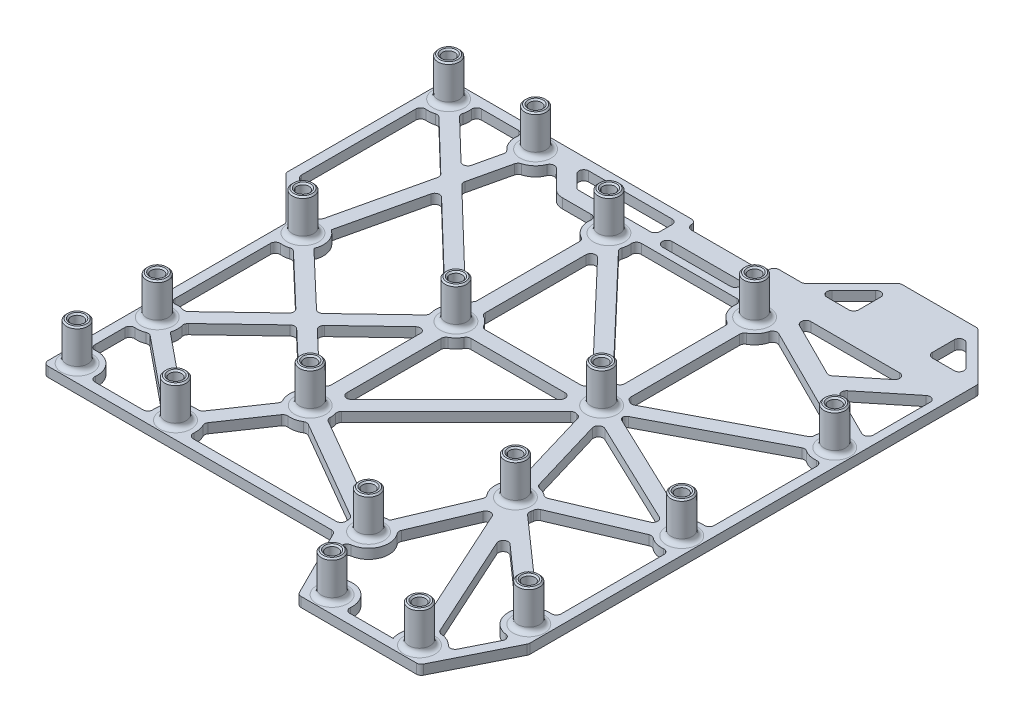
from build123d import *

# Parameters (mm, degrees)
SKETCH1_R                = 1.905
SKETCH1_R_2              = 1.904999999
BOSS_EXTRUDE1_DEPTH      = 2.54
FILLET2_R                = 1.27
BOSS_EXTRUDE2_DEPTH      = 10.16
BOSS_EXTRUDE2_DEPTH_BACK = 2.54
SKETCH3_R                = 2.794
SKETCH3_R_2              = 2.793999999
SKETCH4_R                = 1.5875
CUT_EXTRUDE1_DEPTH       = 119.202141478
CUT_EXTRUDE3_DEPTH       = 2.54
FILLET4_R                = 1.27
BOSS_EXTRUDE3_DEPTH      = 2.54
FILLET5_R                = 1.27
BOSS_EXTRUDE4_DEPTH      = 2.54
FILLET6_R                = 1.27
CUT_EXTRUDE4_DEPTH       = 2.54
CUT_EXTRUDE6_DEPTH       = 2.54
FILLET7_SIZE             = 0.381


with BuildPart() as part:
    # Sketch1 → Boss-Extrude1 (new body)
    with BuildSketch(Plane(origin=(0, 0, 0), x_dir=(1, 0, 0), z_dir=(0, 1, 0))):
        Polygon((-24.130000001, 34.925), (31.115, 34.925), (73.025, 13.97), (73.025, -73.025), (63.5, -92.075), (31.75, -92.075), (22.225, -73.025), (-53.975, -73.025), (-53.975, -9.525), (-65.405000001, 1.905000001), (-65.405000001, 44.45), (-33.655000002, 44.45), align=None)
        with Locations(Location((-9.525, 30.48, 0), (0, 0, 270))):
            Circle(SKETCH1_R, mode=Mode.SUBTRACT)
        with Locations(Location((28.575, 30.48, 0), (0, 0, 270))):
            Circle(SKETCH1_R, mode=Mode.SUBTRACT)
        with Locations(Location((-49.53, -9.525, 0), (0, 0, 270))):
            Circle(SKETCH1_R, mode=Mode.SUBTRACT)
        with Locations(Location((-49.53, -47.625, 0), (0, 0, 270))):
            Circle(SKETCH1_R, mode=Mode.SUBTRACT)
        with Locations(Location((68.58, 11.43, 0), (0, 0, 270))):
            Circle(SKETCH1_R, mode=Mode.SUBTRACT)
        with Locations(Location((68.58, -28.575, 0), (0, 0, 270))):
            Circle(SKETCH1_R, mode=Mode.SUBTRACT)
        with Locations(Location((68.58, -68.58, 0), (0, 0, 270))):
            Circle(SKETCH1_R, mode=Mode.SUBTRACT)
        with Locations(Location((59.055, -87.63, 0), (0, 0, 270))):
            Circle(SKETCH1_R, mode=Mode.SUBTRACT)
        with Locations(Location((36.195, -87.63, 0), (0, 0, 90))):
            Circle(SKETCH1_R, mode=Mode.SUBTRACT)
        with Locations(Location((26.67, -68.58, 0), (0, 0, 90))):
            Circle(SKETCH1_R, mode=Mode.SUBTRACT)
        with Locations(Location((-49.53, -68.58, 0), (0, 0, 270))):
            Circle(SKETCH1_R, mode=Mode.SUBTRACT)
        with Locations(Location((-23.8125, -68.58, 0), (0, 0, 270))):
            Circle(SKETCH1_R, mode=Mode.SUBTRACT)
        with Locations(Location((38.1, -41.5925, 0), (0, 0, 270))):
            Circle(SKETCH1_R, mode=Mode.SUBTRACT)
        with Locations(Location((-9.525, -9.525, 0), (0, 0, 270))):
            Circle(SKETCH1_R, mode=Mode.SUBTRACT)
        with Locations(Location((-9.525, -47.625, 0), (0, 0, 270))):
            Circle(SKETCH1_R, mode=Mode.SUBTRACT)
        with Locations(Location((28.575, -9.525, 0), (0, 0, 270))):
            Circle(SKETCH1_R, mode=Mode.SUBTRACT)
        with Locations(Location((-60.833000001, 39.878, 0), (0, 0, 270))):
            Circle(SKETCH1_R_2, mode=Mode.SUBTRACT)
        with Locations(Location((-38.100000001, 39.878, 0), (0, 0, 270))):
            Circle(SKETCH1_R, mode=Mode.SUBTRACT)
    extrude(amount=BOSS_EXTRUDE1_DEPTH)

    # Fillet2
    fillet2_edges = [part.edges().sort_by_distance(p)[0] for p in [
        (-24.130000001, 1.27, -34.925),
        (31.115, 1.27, -34.925),
        (73.025, 1.27, -13.97),
        (73.025, 1.27, 73.025),
        (63.5, 1.27, 92.075),
        (31.75, 1.27, 92.075),
        (22.225, 1.27, 73.025),
        (-53.975, 1.27, 73.025),
        (-53.975, 1.27, 9.525),
        (-65.405000001, 1.27, -1.905000001),
        (-65.405000001, 1.27, -44.45),
        (-33.655000002, 1.27, -44.45),
    ]]
    fillet(fillet2_edges, radius=FILLET2_R)

    # Sketch3 → Boss-Extrude2 (add, two sides: drawn at the far end of the back side and taken through both)
    with BuildSketch(Plane(origin=(0, 2.54, 0), x_dir=(1, 0, 0), z_dir=(0, 1, 0)).offset(-BOSS_EXTRUDE2_DEPTH_BACK)):
        with Locations(Location((-9.525, 30.48, 0), (0, 0, 270))):
            Circle(SKETCH3_R)
        with Locations(Location((28.575, 30.48, 0), (0, 0, 270))):
            Circle(SKETCH3_R)
        with Locations(Location((-49.53, -9.525, 0), (0, 0, 270))):
            Circle(SKETCH3_R)
        with Locations(Location((-49.53, -47.625, 0), (0, 0, 270))):
            Circle(SKETCH3_R)
        with Locations(Location((68.58, 11.43, 0), (0, 0, 270))):
            Circle(SKETCH3_R)
        with Locations(Location((68.58, -28.575, 0), (0, 0, 270))):
            Circle(SKETCH3_R)
        with Locations(Location((68.58, -68.58, 0), (0, 0, 270))):
            Circle(SKETCH3_R)
        with Locations(Location((36.195, -87.63, 0), (0, 0, 270))):
            Circle(SKETCH3_R)
        with Locations(Location((59.055, -87.63, 0), (0, 0, 270))):
            Circle(SKETCH3_R)
        with Locations(Location((26.67, -68.58, 0), (0, 0, 270))):
            Circle(SKETCH3_R)
        with Locations(Location((-49.53, -68.58, 0), (0, 0, 270))):
            Circle(SKETCH3_R)
        with Locations(Location((-23.8125, -68.58, 0), (0, 0, 270))):
            Circle(SKETCH3_R)
        with Locations(Location((38.1, -41.5925, 0), (0, 0, 270))):
            Circle(SKETCH3_R)
        with Locations(Location((-9.525, -9.525, 0), (0, 0, 270))):
            Circle(SKETCH3_R)
        with Locations(Location((-9.525, -47.625, 0), (0, 0, 270))):
            Circle(SKETCH3_R)
        with Locations(Location((28.575, -9.525, 0), (0, 0, 270))):
            Circle(SKETCH3_R)
        with Locations(Location((-60.833000001, 39.878, 0), (0, 0, 270))):
            Circle(SKETCH3_R_2)
        with Locations(Location((-38.100000001, 39.878, 0), (0, 0, 270))):
            Circle(SKETCH3_R)
    extrude(amount=BOSS_EXTRUDE2_DEPTH + BOSS_EXTRUDE2_DEPTH_BACK)

    # Sketch4 → Cut-Extrude1 (cut, through all)
    with BuildSketch(Plane(origin=(0, 12.7, 0), x_dir=(1, 0, 0), z_dir=(0, 1, 0))):
        with Locations(Location((-60.833000001, 39.878, 0), (0, 0, 270))):
            Circle(SKETCH4_R)
        with Locations(Location((-38.100000001, 39.878, 0), (0, 0, 270))):
            Circle(SKETCH4_R)
        with Locations(Location((-49.53, -9.525, 0), (0, 0, 270))):
            Circle(SKETCH4_R)
        with Locations(Location((-49.53, -47.625, 0), (0, 0, 270))):
            Circle(SKETCH4_R)
        with Locations(Location((-49.53, -68.58, 0), (0, 0, 270))):
            Circle(SKETCH4_R)
        with Locations(Location((-23.8125, -68.58, 0), (0, 0, 270))):
            Circle(SKETCH4_R)
        with Locations(Location((-9.525, -47.625, 0), (0, 0, 270))):
            Circle(SKETCH4_R)
        with Locations(Location((-9.525, -9.525, 0), (0, 0, 270))):
            Circle(SKETCH4_R)
        with Locations(Location((-9.525, 30.48, 0), (0, 0, 270))):
            Circle(SKETCH4_R)
        with Locations(Location((28.575, 30.48, 0), (0, 0, 270))):
            Circle(SKETCH4_R)
        with Locations(Location((28.575, -9.525, 0), (0, 0, 270))):
            Circle(SKETCH4_R)
        with Locations(Location((38.1, -41.5925, 0), (0, 0, 270))):
            Circle(SKETCH4_R)
        with Locations(Location((26.67, -68.58, 0), (0, 0, 270))):
            Circle(SKETCH4_R)
        with Locations(Location((36.195, -87.63, 0), (0, 0, 270))):
            Circle(SKETCH4_R)
        with Locations(Location((59.055, -87.63, 0), (0, 0, 270))):
            Circle(SKETCH4_R)
        with Locations(Location((68.58, -68.58, 0), (0, 0, 270))):
            Circle(SKETCH4_R)
        with Locations(Location((68.58, -28.575, 0), (0, 0, 270))):
            Circle(SKETCH4_R)
        with Locations(Location((68.58, 11.43, 0), (0, 0, 270))):
            Circle(SKETCH4_R)
    extrude(amount=-CUT_EXTRUDE1_DEPTH, mode=Mode.SUBTRACT)

    # Sketch7 → Cut-Extrude3 (cut)
    with BuildSketch(Plane(origin=(0, 2.54, 0), x_dir=(1, 0, 0), z_dir=(0, 1, 0))):
        with BuildLine():
            Line((-32.28975, -28.575), (-47.23597754, -14.340497581))
            ThreePointArc((-47.23597754, -14.340497581), (-49.318378087, -14.854800387), (-51.435, -14.507221492))
            Line((-51.435, -14.507221492), (-51.435, -42.642778508))
            ThreePointArc((-51.435, -42.642778508), (-49.318378087, -42.295199613), (-47.23597754, -42.809502419))
            Line((-47.23597754, -42.809502419), (-32.28975, -28.575))
        make_face()
        with BuildLine():
            Line((-14.435281376, -7.441567061), (-41.142927348, 18.274458392))
            Line((-41.142927348, 18.274458392), (-46.550992638, -5.100401585))
            ThreePointArc((-46.550992638, -5.100401585), (-44.420577676, -7.993543335), (-44.608391333, -11.581532064))
            Line((-44.608391333, -11.581532064), (-29.5275, -25.944285714))
            Line((-29.5275, -25.944285714), (-14.446608667, -11.581532064))
            ThreePointArc((-14.446608667, -11.581532064), (-14.858980035, -9.510405784), (-14.435281376, -7.441567061))
        make_face()
        with BuildLine():
            ThreePointArc((-58.5653629, 35.050021336), (-60.704254901, 34.545553967), (-62.865000001, 34.946212089))
            Line((-62.865000001, 34.946212089), (-62.865000001, 2.957102449))
            Line((-62.865000001, 2.957102449), (-53.703970549, -6.203927002))
            ThreePointArc((-53.703970549, -6.203927002), (-52.172371724, -4.891488624), (-50.26294003, -4.241596276))
            Line((-50.26294003, -4.241596276), (-44.341104785, 21.353891617))
            Line((-44.341104785, 21.353891617), (-58.5653629, 35.050021336))
        make_face()
        with BuildLine():
            ThreePointArc((-41.079007363, 35.453401585), (-43.205593623, 38.333827158), (-43.031787913, 41.909999998))
            Line((-43.031787913, 41.909999998), (-55.901212089, 41.909999998))
            ThreePointArc((-55.901212089, 41.909999998), (-55.499072833, 39.850125825), (-55.922718625, 37.794567061))
            Line((-55.922718625, 37.794567061), (-43.340352006, 25.67936752))
            Line((-43.340352006, 25.67936752), (-41.079007363, 35.453401585))
        make_face()
        with BuildLine():
            Line((-26.298025613, 33.500923164), (-32.766788047, 39.969685597))
            ThreePointArc((-32.766788047, 39.969685597), (-34.047538246, 36.409699303), (-37.367059971, 34.594596276))
            Line((-37.367059971, 34.594596276), (-40.142174568, 22.599934294))
            Line((-40.142174568, 22.599934294), (-11.792637101, -4.697021336))
            ThreePointArc((-11.792637101, -4.697021336), (-11.612743472, -4.616549818), (-11.43, -4.542778508))
            Line((-11.43, -4.542778508), (-11.43, 25.497778508))
            ThreePointArc((-11.43, 25.497778508), (-14.395001021, 28.304075815), (-14.507221492, 32.385))
            Line((-14.507221492, 32.385), (-23.603948777, 32.385))
            ThreePointArc((-23.603948777, 32.385), (-25.061972654, 32.675018981), (-26.298025613, 33.500923164))
        make_face()
        with BuildLine():
            Line((-7.62, 25.497778508), (-7.62, -4.542778508))
            ThreePointArc((-7.62, -4.542778508), (-5.753292429, -5.753292429), (-4.542778508, -7.62))
            Line((-4.542778508, -7.62), (23.592778508, -7.62))
            ThreePointArc((23.592778508, -7.62), (23.67228041, -7.423834461), (23.759502419, -7.23097754))
            Line((23.759502419, -7.23097754), (-7.468467936, 25.558391333))
            ThreePointArc((-7.468467936, 25.558391333), (-7.544002132, 25.527505331), (-7.62, 25.497778508))
        make_face()
        with BuildLine():
            Line((23.592778508, 32.385), (-4.542778508, 32.385))
            ThreePointArc((-4.542778508, 32.385), (-4.195199613, 30.268378087), (-4.709502419, 28.18597754))
            Line((-4.709502419, 28.18597754), (26.518467936, -4.603391333))
            ThreePointArc((26.518467936, -4.603391333), (26.594002132, -4.572505331), (26.67, -4.542778508))
            Line((26.67, -4.542778508), (26.67, 25.497778508))
            ThreePointArc((26.67, 25.497778508), (23.704998979, 28.304075815), (23.592778508, 32.385))
        make_face()
        with BuildLine():
            ThreePointArc((33.904854026, 30.690266656), (33.027669029, 27.543114828), (30.48, 25.497778508))
            Line((30.48, 25.497778508), (30.48, -4.542778508))
            ThreePointArc((30.48, -4.542778508), (31.336325316, -4.961378796), (32.104475589, -5.525705304))
            Line((32.104475589, -5.525705304), (63.282657761, 10.805723453))
            ThreePointArc((63.282657761, 10.805723453), (63.5465717, 13.195263592), (64.832959201, 15.226214068))
            Line((64.832959201, 15.226214068), (33.904854026, 30.690266656))
        make_face()
        with BuildLine():
            Line((65.050524411, 7.430705304), (33.872342239, -8.900723453))
            ThreePointArc((33.872342239, -8.900723453), (33.899827673, -9.21232405), (33.909, -9.525))
            ThreePointArc((33.909, -9.525), (33.904816998, -9.736203147), (33.892274552, -9.947075036))
            Line((33.892274552, -9.947075036), (64.900772389, -24.713026387))
            ThreePointArc((64.900772389, -24.713026387), (67.530852855, -23.345196345), (70.485, -23.592778508))
            Line((70.485, -23.592778508), (70.485, 6.447778508))
            ThreePointArc((70.485, 6.447778508), (67.630649429, 6.181163034), (65.050524411, 7.430705304))
        make_face()
        with BuildLine():
            ThreePointArc((32.254227611, -13.386973613), (32.041973878, -13.578596937), (31.819755895, -13.758570028))
            Line((31.819755895, -13.758570028), (38.507534475, -36.274091248))
            ThreePointArc((38.507534475, -36.274091248), (40.368178975, -36.764775884), (41.933635977, -37.883754768))
            Line((41.933635977, -37.883754768), (63.249937639, -28.7799176))
            ThreePointArc((63.249937639, -28.7799176), (63.24710906, -28.466233185), (63.262725448, -28.152924964))
            Line((63.262725448, -28.152924964), (32.254227611, -13.386973613))
        make_face()
        with BuildLine():
            ThreePointArc((28.167465525, -14.843408752), (27.263957653, -14.695369809), (26.399075815, -14.395001021))
            Line((26.399075815, -14.395001021), (-4.654998979, -45.449075815))
            ThreePointArc((-4.654998979, -45.449075815), (-4.308289281, -46.512576844), (-4.191, -47.625))
            ThreePointArc((-4.191, -47.625), (-4.207972118, -48.050171142), (-4.258780465, -48.472636602))
            Line((-4.258780465, -48.472636602), (23.312728656, -64.435089251))
            ThreePointArc((23.312728656, -64.435089251), (24.978497678, -63.521306899), (26.858875669, -63.24934507))
            Line((26.858875669, -63.24934507), (34.402809021, -45.43728021))
            ThreePointArc((34.402809021, -45.43728021), (32.774345839, -41.294232072), (34.855244105, -37.358929972))
            Line((34.855244105, -37.358929972), (28.167465525, -14.843408752))
        make_face()
        with BuildLine():
            ThreePointArc((-4.542778508, -11.43), (-5.753292429, -13.296707571), (-7.62, -14.507221492))
            Line((-7.62, -14.507221492), (-7.62, -42.642778508))
            ThreePointArc((-7.62, -42.642778508), (-7.483766572, -42.697026574), (-7.349075815, -42.754998979))
            Line((-7.349075815, -42.754998979), (23.704998979, -11.700924185))
            ThreePointArc((23.704998979, -11.700924185), (23.647026574, -11.566233428), (23.592778508, -11.43))
            Line((23.592778508, -11.43), (-4.542778508, -11.43))
        make_face()
        with BuildLine():
            ThreePointArc((-11.43, -14.507221492), (-11.626165539, -14.42771959), (-11.81902246, -14.340497581))
            Line((-11.81902246, -14.340497581), (-26.76525, -28.575))
            Line((-26.76525, -28.575), (-11.81902246, -42.809502419))
            ThreePointArc((-11.81902246, -42.809502419), (-11.626165539, -42.72228041), (-11.43, -42.642778508))
            Line((-11.43, -42.642778508), (-11.43, -14.507221492))
        make_face()
        with BuildLine():
            Line((-14.446608667, -45.568467936), (-29.5275, -31.205714286))
            Line((-29.5275, -31.205714286), (-44.608391333, -45.568467936))
            ThreePointArc((-44.608391333, -45.568467936), (-44.199983883, -47.418883049), (-44.464270621, -49.295311906))
            Line((-44.464270621, -49.295311906), (-26.471555435, -63.956042799))
            ThreePointArc((-26.471555435, -63.956042799), (-24.579707606, -63.301463414), (-22.579794253, -63.390395724))
            Line((-22.579794253, -63.390395724), (-13.905631923, -50.668290974))
            ThreePointArc((-13.905631923, -50.668290974), (-14.829240639, -48.187660862), (-14.446608667, -45.568467936))
        make_face()
        with BuildLine():
            ThreePointArc((-46.870944565, -52.248957201), (-49.112581475, -52.942642125), (-51.435, -52.607221492))
            Line((-51.435, -52.607221492), (-51.435, -63.597778508))
            ThreePointArc((-51.435, -63.597778508), (-45.758292429, -64.808292429), (-44.547778508, -70.485))
            Line((-44.547778508, -70.485), (-28.794721492, -70.485))
            ThreePointArc((-28.794721492, -70.485), (-29.145045638, -68.704551263), (-28.878229379, -66.909688094))
            Line((-28.878229379, -66.909688094), (-46.870944565, -52.248957201))
        make_face()
        with BuildLine():
            ThreePointArc((-6.167728656, -51.769910749), (-8.341238671, -52.825986937), (-10.757705747, -52.814604276))
            Line((-10.757705747, -52.814604276), (-19.431868077, -65.536709026))
            ThreePointArc((-19.431868077, -65.536709026), (-18.517488016, -67.936257747), (-18.830278508, -70.485))
            Line((-18.830278508, -70.485), (21.440096834, -70.485))
            Line((21.440096834, -70.485), (21.687778508, -70.485))
            ThreePointArc((21.687778508, -70.485), (21.364164727, -69.127419456), (21.403780465, -67.732363398))
            Line((21.403780465, -67.732363398), (-6.167728656, -51.769910749))
        make_face()
        with BuildLine():
            ThreePointArc((38.430175423, -46.916271238), (38.170733666, -46.926030983), (37.911124331, -46.92315493))
            Line((37.911124331, -46.92315493), (30.367190979, -64.73521979))
            ThreePointArc((30.367190979, -64.73521979), (31.352196239, -71.135111423), (25.437083428, -73.769554193))
            Line((25.437083428, -73.769554193), (31.303606702, -85.502600741))
            ThreePointArc((31.303606702, -85.502600741), (38.211711032, -82.6919404), (41.177221492, -89.535))
            Line((41.177221492, -89.535), (54.072778508, -89.535))
            ThreePointArc((54.072778508, -89.535), (53.834451816, -86.535727338), (55.257147773, -83.884619583))
            Line((55.257147773, -83.884619583), (38.430175423, -46.916271238))
        make_face()
        with BuildLine():
            Line((43.546062929, -48.958949384), (58.724824577, -82.306228762))
            ThreePointArc((58.724824577, -82.306228762), (61.839847497, -83.080694513), (63.946393298, -85.502600741))
            Line((63.946393298, -85.502600741), (69.812916572, -73.769554193))
            ThreePointArc((69.812916572, -73.769554193), (64.577891618, -72.106284801), (63.586972658, -66.703504873))
            Line((63.586972658, -66.703504873), (43.546062929, -48.958949384))
        make_face()
        with BuildLine():
            Line((64.746364023, -32.283745232), (43.430062361, -41.3875824))
            ThreePointArc((43.430062361, -41.3875824), (43.4330155, -41.490022286), (43.434, -41.5925))
            ThreePointArc((43.434, -41.5925), (43.348064588, -42.546111073), (43.093027342, -43.468995127))
            Line((43.093027342, -43.468995127), (66.112661157, -63.850962568))
            ThreePointArc((66.112661157, -63.850962568), (68.271646655, -63.254920262), (70.485, -63.597778508))
            Line((70.485, -63.597778508), (70.485, -33.557221492))
            ThreePointArc((70.485, -33.557221492), (67.424428873, -33.78232286), (64.746364023, -32.283745232))
        make_face()
    extrude(amount=-CUT_EXTRUDE3_DEPTH, mode=Mode.SUBTRACT)

    # Fillet4
    # the kernel refuses this fillet: 1.27 mm, written as the material it adds along each edge
    with BuildSketch(Plane(origin=(-26.76525, 2.54, 28.575), x_dir=(0.724137931034534, 0, 0.6896551724137392), z_dir=(0, -1, 0)), Plane(origin=(-32.28975, 2.54, 28.575), x_dir=(-0.7241379310345379, 0, -0.6896551724137352), z_dir=(0, -1, 0))) as fillet4_piece_1:
        with BuildLine():
            CenterArc((FILLET4_R * 1.05, -FILLET4_R), FILLET4_R, 90, 92.794362055)
            Line((FILLET4_R * 0.0511890606423, -FILLET4_R * 1.04875148633), (0, 0))
            Line((0, 0), (FILLET4_R * 1.05, 0))
        make_face()
    extrude(amount=2.54)
    with BuildSketch(Plane(origin=(-4.542778508, 2.54, 11.43), x_dir=(1, 0, 0), z_dir=(0, -1, 0)), Plane(origin=(-6.167728656, 2.54, 51.769910749), x_dir=(0.8654262854811297, 0, 0.5010362705416985), z_dir=(0, -1, 0)), Plane(origin=(-26.471555435, 2.54, 63.956042799), x_dir=(-0.7752349855172392, 0, -0.6316729511622972), z_dir=(0, -1, 0)), Plane(origin=(-46.870944565, 2.54, 52.248957201), x_dir=(0.7752349855172418, 0, 0.631672951162294), z_dir=(0, -1, 0)), Plane(origin=(63.282657761, 2.54, -10.805723453), x_dir=(-0.8858315352801304, 0, 0.4640069946706056), z_dir=(0, -1, 0)), Plane(origin=(26.67, 2.54, -25.497778508), x_dir=(0, 0, 1), z_dir=(0, -1, 0)), Plane(origin=(-58.5653629, 2.54, -35.050021336), x_dir=(0.720353208670372, 0, 0.6936074212105141), z_dir=(0, -1, 0)), Plane(origin=(-14.446608667, 2.54, 11.581532064), x_dir=(-0.7241379310345665, 0, 0.6896551724137052), z_dir=(0, -1, 0)), Plane(origin=(-41.079007363, 2.54, -35.453401585), x_dir=(-0.22540821761759244, 0, 0.9742644073507253), z_dir=(0, -1, 0)), Plane(origin=(66.112661157, 2.54, 63.850962568), x_dir=(-0.7486987677964876, 0, -0.6629103673197615), z_dir=(0, -1, 0))) as fillet4_piece_2:
        with BuildLine():
            CenterArc((0.80847717, 1.27), FILLET4_R, 208.735653745, 61.264346255)
            ThreePointArc((-0.305118727, 0.659423077), (-0.141318066, 0.334912949), (0, 0))
            Line((0, 0), (0.80847717, 0))
        make_face()
    extrude(amount=2.54)
    with BuildSketch(Plane(origin=(-7.62, 2.54, 14.507221492), x_dir=(0, 0, 1), z_dir=(0, -1, 0)), Plane(origin=(41.933635977, 2.54, 37.883754768), x_dir=(0.919639798457005, 0, -0.39276283059113304), z_dir=(0, -1, 0)), Plane(origin=(-4.258780465, 2.54, 48.472636602), x_dir=(0.8654262854811545, 0, 0.5010362705416558), z_dir=(0, -1, 0)), Plane(origin=(26.399075815, 2.54, 14.395001021), x_dir=(-0.7071067811865871, 0, 0.707106781186508), z_dir=(0, -1, 0)), Plane(origin=(21.403780465, 2.54, 67.732363398), x_dir=(-0.8654262854811073, 0, -0.5010362705417373), z_dir=(0, -1, 0)), Plane(origin=(-10.757705747, 2.54, 52.814604276), x_dir=(-0.5633368246416713, 0, 0.8262273428074375), z_dir=(0, -1, 0)), Plane(origin=(-14.446608667, 2.54, 45.568467936), x_dir=(-0.7241379310345635, 0, -0.6896551724137084), z_dir=(0, -1, 0)), Plane(origin=(-22.579794253, 2.54, 63.390395724), x_dir=(0.5633368246416699, 0, -0.8262273428074386), z_dir=(0, -1, 0)), Plane(origin=(-28.878229379, 2.54, 66.909688094), x_dir=(-0.7752349855172788, 0, -0.6316729511622486), z_dir=(0, -1, 0)), Plane(origin=(30.48, 2.54, -25.497778508), x_dir=(0, 0, 1), z_dir=(0, -1, 0)), Plane(origin=(32.104475589, 2.54, 5.525705304), x_dir=(0.8858315352801891, 0, -0.4640069946704932), z_dir=(0, -1, 0)), Plane(origin=(33.892274552, 2.54, 9.947075036), x_dir=(0.9028605188239747, 0, 0.42993358039225477), z_dir=(0, -1, 0)), Plane(origin=(-4.542778508, 2.54, 7.62), x_dir=(1, 0, 0), z_dir=(0, -1, 0)), Plane(origin=(-4.709502419, 2.54, -28.18597754), x_dir=(0.6896551724137642, 0, 0.7241379310345104), z_dir=(0, -1, 0)), Plane(origin=(-50.26294003, 2.54, 4.241596276), x_dir=(0.22540821761752847, 0, -0.97426440735074), z_dir=(0, -1, 0)), Plane(origin=(-14.435281376, 2.54, 7.441567061), x_dir=(-0.720353208670406, 0, -0.6936074212104788), z_dir=(0, -1, 0)), Plane(origin=(-55.922718625, 2.54, -37.794567061), x_dir=(0.7203532086704016, 0, 0.6936074212104834), z_dir=(0, -1, 0)), Plane(origin=(-37.367059971, 2.54, -34.594596276), x_dir=(-0.2254082176175211, 0, 0.9742644073507418), z_dir=(0, -1, 0)), Plane(origin=(43.093027342, 2.54, 43.468995127), x_dir=(0.7486987677965211, 0, 0.6629103673197235), z_dir=(0, -1, 0)), Plane(origin=(64.746364023, 2.54, 32.283745232), x_dir=(-0.9196397984570056, 0, 0.392762830591132), z_dir=(0, -1, 0)), Plane(origin=(-47.23597754, 2.54, 42.809502419), x_dir=(0.7241379310345717, 0, -0.6896551724136996), z_dir=(0, -1, 0))) as fillet4_piece_3:
        with BuildLine():
            CenterArc((0.80847717, -1.27), FILLET4_R, 90, 61.264346255)
            ThreePointArc((-0.305118727, -0.659423077), (-0.141318066, -0.334912949), (0, 0))
            Line((0, 0), (0.80847717, 0))
        make_face()
    extrude(amount=2.54)
    with BuildSketch(Plane(origin=(38.507534475, 2.54, 36.274091248), x_dir=(0.989557863722872, 0, 0.14413616598281503), z_dir=(0, -1, 0)), Plane(origin=(-4.654998979, 2.54, 45.449075815), x_dir=(0.34480277541816917, 0, 0.9386751547068494), z_dir=(0, -1, 0)), Plane(origin=(34.402809021, 2.54, 45.43728021), x_dir=(-0.6719231740010451, 0, -0.740620853230829), z_dir=(0, -1, 0)), Plane(origin=(28.167465525, 2.54, 14.843408752), x_dir=(-0.9895578637228755, 0, -0.1441361659827925), z_dir=(0, -1, 0)), Plane(origin=(30.367190979, 2.54, 64.73521979), x_dir=(0.6719231740009847, 0, 0.7406208532308838), z_dir=(0, -1, 0)), Plane(origin=(-19.431868077, 2.54, 65.536709026), x_dir=(0.5132848380764649, 0, 0.858218314300515), z_dir=(0, -1, 0)), Plane(origin=(-13.905631923, 2.54, 50.668290974), x_dir=(-0.5132848380764508, 0, -0.8582183143005232), z_dir=(0, -1, 0)), Plane(origin=(-44.608391333, 2.54, 45.568467936), x_dir=(0.3218125531119515, 0, 0.9468034012716512), z_dir=(0, -1, 0)), Plane(origin=(30.48, 2.54, 4.542778508), x_dir=(0.9075559478945641, 0, 0.4199311865546539), z_dir=(0, -1, 0)), Plane(origin=(64.900772389, 2.54, 24.713026387), x_dir=(0.7693280670475996, 0, -0.6388539154241791), z_dir=(0, -1, 0)), Plane(origin=(33.872342239, 2.54, 8.900723453), x_dir=(0.049124020180445975, 0, 0.9987926865177333), z_dir=(0, -1, 0)), Plane(origin=(-7.62, 2.54, 4.542778508), x_dir=(0.907555947894656, 0, 0.419931186554455), z_dir=(0, -1, 0)), Plane(origin=(-11.43, 2.54, -25.497778508), x_dir=(-0.9075559478946158, 0, -0.4199311865545418), z_dir=(0, -1, 0)), Plane(origin=(43.430062361, 2.54, 41.3875824), x_dir=(-0.029731188753956167, 0, 0.9995579304949147), z_dir=(0, -1, 0)), Plane(origin=(58.724824577, 2.54, 82.306228762), x_dir=(0.9999806401704162, 0, 0.006222482170696958), z_dir=(0, -1, 0)), Plane(origin=(-47.23597754, 2.54, 14.340497581), x_dir=(-0.9299887543288152, 0, 0.3675879715414237), z_dir=(0, -1, 0))) as fillet4_piece_4:
        with BuildLine():
            CenterArc((0.813091277, -1.267050871), FILLET4_R, 93.905410659, 61.264346255)
            Line((-0.339504777, -0.733738264), (0, 0))
            ThreePointArc((0, 0), (0.363296102, -0.01238634), (0.726592205, 0))
        make_face()
    extrude(amount=2.54)
    with BuildSketch(Plane(origin=(34.855244105, 2.54, 37.358929972), x_dir=(-0.7504200094252371, 0, 0.6609612768190184), z_dir=(0, -1, 0)), Plane(origin=(65.050524411, 2.54, -7.430705304), x_dir=(0.793100595575542, 0, 0.6090906708345817), z_dir=(0, -1, 0)), Plane(origin=(63.586972658, 2.54, 66.703504873), x_dir=(-0.2872262848494402, 0, 0.9578627570229402), z_dir=(0, -1, 0))) as fillet4_piece_5:
        with BuildLine():
            CenterArc((0.813091277, 1.267050871), FILLET4_R, 204.830243086, 61.264346255)
            Line((-0.339504777, 0.733738264), (0, 0))
            ThreePointArc((0, 0), (0.363296102, 0.01238634), (0.726592205, 0))
        make_face()
    extrude(amount=2.54)
    with BuildSketch(Plane(origin=(41.177221492, 2.54, 89.535), x_dir=(1, 0, 0), z_dir=(0, -1, 0)), Plane(origin=(-18.830278508, 2.54, 70.485), x_dir=(1, 0, 0), z_dir=(0, -1, 0)), Plane(origin=(-51.435, 2.54, 52.607221492), x_dir=(0, 0, 1), z_dir=(0, -1, 0)), Plane(origin=(-44.547778508, 2.54, 70.485), x_dir=(1, 0, 0), z_dir=(0, -1, 0)), Plane(origin=(70.485, 2.54, 23.592778508), x_dir=(0, 0, -1), z_dir=(0, -1, 0)), Plane(origin=(23.592778508, 2.54, -32.385), x_dir=(-1, 0, 0), z_dir=(0, -1, 0)), Plane(origin=(-14.507221492, 2.54, -32.385), x_dir=(-1, 0, 0), z_dir=(0, -1, 0)), Plane(origin=(70.485, 2.54, 63.597778508), x_dir=(0, 0, -1), z_dir=(0, -1, 0)), Plane(origin=(-51.435, 2.54, 14.507221492), x_dir=(0, 0, 1), z_dir=(0, -1, 0))) as fillet4_piece_6:
        with BuildLine():
            CenterArc((1.591178769, -1.27), FILLET4_R, 90, 95.517734374)
            ThreePointArc((0.327063334, -1.392115385), (0.210395564, -0.685047497), (0, 0))
            Line((0, 0), (1.591178769, 0))
        make_face()
    extrude(amount=2.54)
    with BuildSketch(Plane(origin=(31.303606702, 2.54, 85.502600741), x_dir=(0.5585269673652533, 0, -0.8294863631945815), z_dir=(0, -1, 0)), Plane(origin=(69.812916572, 2.54, 73.769554193), x_dir=(-0.9987052709747986, 0, 0.050870244024910825), z_dir=(0, -1, 0))) as fillet4_piece_7:
        with BuildLine():
            CenterArc((2.164968589, -1.248941403), FILLET4_R, 100.448463337, 109.032496671)
            Line((1.059409096, -1.87395197), (0, 0))
            ThreePointArc((0, 0), (0.967326391, -0.088446106), (1.934652782, 0))
        make_face()
    extrude(amount=2.54)
    with BuildSketch(Plane(origin=(25.437083428, 2.54, 73.769554193), x_dir=(0.4472135954999831, 0, 0.8944271909999034), z_dir=(0, -1, 0)), Plane(origin=(63.946393298, 2.54, 85.502600741), x_dir=(0.44721359549984707, 0, -0.8944271909999714), z_dir=(0, -1, 0))) as fillet4_piece_8:
        with BuildLine():
            CenterArc((2.152682889, -1.27), FILLET4_R, 90, 109.032496671)
            ThreePointArc((0.952109001, -1.684152557), (0.553048542, -0.798548916), (0, 0))
            Line((0, 0), (2.152682889, 0))
        make_face()
    extrude(amount=2.54)
    with BuildSketch(Plane(origin=(21.687778508, 2.54, 70.485), x_dir=(-0.22871250524211195, 0, -0.9734940112532162), z_dir=(0, -1, 0)), Plane(origin=(-51.435, 2.54, 63.597778508), x_dir=(0.9734940112532507, 0, -0.2287125052419644), z_dir=(0, -1, 0)), Plane(origin=(-28.794721492, 2.54, 70.485), x_dir=(-0.22871250524224257, 0, -0.9734940112531855), z_dir=(0, -1, 0)), Plane(origin=(70.485, 2.54, -6.447778508), x_dir=(-0.9734940112531726, 0, 0.22871250524229744), z_dir=(0, -1, 0)), Plane(origin=(-4.542778508, 2.54, -32.385), x_dir=(0.22871250524206235, 0, 0.9734940112532278), z_dir=(0, -1, 0)), Plane(origin=(70.485, 2.54, 33.557221492), x_dir=(-0.9734940112531422, 0, 0.22871250524242626), z_dir=(0, -1, 0))) as fillet4_piece_9:
        with BuildLine():
            CenterArc((1.600259877, -1.258538121), FILLET4_R, 97.703549027, 95.517734374)
            Line((0.363922483, -1.549003003), (0, 0))
            ThreePointArc((0, 0), (0.715009732, -0.048139892), (1.430019464, 0))
        make_face()
    extrude(amount=2.54)
    with BuildSketch(Plane(origin=(-29.5275, 2.54, 31.205714286), x_dir=(-0.7241379310345438, 0, 0.6896551724137291), z_dir=(0, -1, 0)), Plane(origin=(-29.5275, 2.54, 25.944285714), x_dir=(0.7241379310345424, 0, -0.6896551724137304), z_dir=(0, -1, 0))) as fillet4_piece_10:
        with BuildLine():
            CenterArc((FILLET4_R * 0.952380952381, -FILLET4_R), FILLET4_R, 90, 87.205637945)
            Line((-FILLET4_R * 0.0464299869771, -FILLET4_R * 0.951248513674), (0, 0))
            Line((0, 0), (FILLET4_R * 0.952380952381, 0))
        make_face()
    extrude(amount=2.54)
    with BuildSketch(Plane(origin=(64.832959201, 2.54, -15.226214068), x_dir=(-0.8944271909999192, 0, -0.4472135954999515), z_dir=(0, -1, 0))) as fillet4_piece_11:
        with BuildLine():
            CenterArc((1.53949666, -1.27), FILLET4_R, 90, 93.904665601)
            ThreePointArc((0.272444664, -1.356482596), (0.180390648, -0.66937025), (0, 0))
            Line((0, 0), (1.53949666, 0))
        make_face()
    extrude(amount=2.54)
    with BuildSketch(Plane(origin=(33.904854026, 2.54, -30.690266656), x_dir=(-0.11266917565009185, 0, 0.9936325562592686), z_dir=(0, -1, 0))) as fillet4_piece_12:
        with BuildLine():
            CenterArc((1.811599454, -1.255291883), FILLET4_R, 98.728393881, 101.367452447)
            Line((0.618918117, -1.691653233), (0, 0))
            ThreePointArc((0, 0), (0.809438054, -0.061774091), (1.618876108, 0))
        make_face()
    extrude(amount=2.54)
    with BuildSketch(Plane(origin=(-62.865000001, 2.54, -34.946212089), x_dir=(0, 0, 1), z_dir=(0, -1, 0))) as fillet4_piece_13:
        with BuildLine():
            CenterArc((1.628103247, -1.27), FILLET4_R, 90, 96.625809565)
            ThreePointArc((0.366585716, -1.416538462), (0.232095955, -0.695639487), (0, 0))
            Line((0, 0), (1.628103247, 0))
        make_face()
    extrude(amount=2.54)
    with BuildSketch(Plane(origin=(-44.341104785, 2.54, -21.353891617), x_dir=(-0.7203532086703925, 0, -0.6936074212104928), z_dir=(0, -1, 0)), Plane(origin=(-40.142174568, 2.54, -22.599934294), x_dir=(0.7203532086703972, 0, 0.6936074212104878), z_dir=(0, -1, 0))) as fillet4_piece_14:
        with BuildLine():
            CenterArc((FILLET4_R * 0.567046825837, -FILLET4_R), FILLET4_R, 90, 59.110533683)
            Line((-FILLET4_R * 0.291112478633, -FILLET4_R * 0.486616509662), (0, 0))
            Line((0, 0), (FILLET4_R * 0.567046825837, 0))
        make_face()
    extrude(amount=2.54)
    with BuildSketch(Plane(origin=(-53.703970549, 2.54, 6.203927002), x_dir=(0.7027983657682508, 0, -0.7113891038478704), z_dir=(0, -1, 0))) as fillet4_piece_15:
        with BuildLine():
            CenterArc((1.277693964, -1.262705201), FILLET4_R, 96.143990527, 84.204058789)
            Line((0.007717396, -1.270419904), (0, 0))
            ThreePointArc((0, 0), (0.570884537, -0.030638156), (1.141769074, 0))
        make_face()
    extrude(amount=2.54)
    with BuildSketch(Plane(origin=(-62.865000001, 2.54, -2.957102449), x_dir=(0.7071067811737977, 0, 0.7071067811992974), z_dir=(0, -1, 0))) as fillet4_piece_16:
        with BuildLine():
            CenterArc((FILLET4_R * 0.414213562363, -FILLET4_R), FILLET4_R, 90, 44.999999999)
            Line((-FILLET4_R * 0.292893218811, -FILLET4_R * 0.292893218801), (0, 0))
            Line((0, 0), (FILLET4_R * 0.414213562363, 0))
        make_face()
    extrude(amount=2.54)
    with BuildSketch(Plane(origin=(-41.142927348, 2.54, -18.274458392), x_dir=(-0.22540821761747157, 0, 0.9742644073507533), z_dir=(0, -1, 0)), Plane(origin=(-43.340352006, 2.54, -25.67936752), x_dir=(0.2254082176174682, 0, -0.9742644073507541), z_dir=(0, -1, 0))) as fillet4_piece_17:
        with BuildLine():
            CenterArc((FILLET4_R * 1.76352278937, -FILLET4_R), FILLET4_R, 90, 120.889466317)
            Line((FILLET4_R * 0.905363484895, -FILLET4_R * 1.51338349034), (0, 0))
            Line((0, 0), (FILLET4_R * 1.76352278937, 0))
        make_face()
    extrude(amount=2.54)
    with BuildSketch(Plane(origin=(-43.031787913, 2.54, -41.909999998), x_dir=(-1, 0, 0), z_dir=(0, -1, 0))) as fillet4_piece_18:
        with BuildLine():
            CenterArc((1.628103246, -1.27), FILLET4_R, 90, 96.625809548)
            ThreePointArc((0.366585716, -1.416538461), (0.232095954, -0.695639487), (0, 0))
            Line((0, 0), (1.628103246, 0))
        make_face()
    extrude(amount=2.54)
    with BuildSketch(Plane(origin=(-55.901212089, 2.54, -41.909999998), x_dir=(0.2505362788638163, 0, 0.9681072115076264), z_dir=(0, -1, 0))) as fillet4_piece_19:
        with BuildLine():
            CenterArc((1.637395087, -1.257997419), FILLET4_R, 97.883439118, 96.625809548)
            Line((0.407898929, -1.576178494), (0, 0))
            ThreePointArc((0, 0), (0.73160206, -0.050410839), (1.463204121, 0))
        make_face()
    extrude(amount=2.54)
    with BuildSketch(Plane(origin=(-32.766788047, 2.54, -39.969685597), x_dir=(-0.18352944649675867, 0, 0.9830142126483186), z_dir=(0, -1, 0))) as fillet4_piece_20:
        with BuildLine():
            CenterArc((2.392366433, -1.244237177), FILLET4_R, 101.560307963, 112.864284043)
            Line((1.344780349, -1.962194973), (0, 0))
            ThreePointArc((0, 0), (1.068929683, -0.108203857), (2.137859365, 0))
        make_face()
    extrude(amount=2.54)
    with BuildSketch(Plane(origin=(43.546062929, 2.54, 48.958949384), x_dir=(0.41427580605351777, 0, 0.9101513920874419), z_dir=(0, -1, 0))) as fillet4_piece_21:
        with BuildLine():
            CenterArc((FILLET4_R * 4.70380906625, -FILLET4_R), FILLET4_R, 90, 155.995932299)
            Line((FILLET4_R * 4.29700756724, -FILLET4_R * 1.91351657917), (0, 0))
            Line((0, 0), (FILLET4_R * 4.70380906625, 0))
        make_face()
    extrude(amount=2.54)
    with BuildSketch(Plane(origin=(-51.435, 2.54, 42.642778508), x_dir=(0, 0, -1), z_dir=(0, -1, 0))) as fillet4_piece_22:
        with BuildLine():
            CenterArc((1.591178769, 1.27), FILLET4_R, 174.482265626, 95.517734374)
            ThreePointArc((0.327063334, 1.392115385), (0.210395564, 0.685047497), (0, 0))
            Line((0, 0), (1.591178769, 0))
        make_face()
    extrude(amount=2.54)

    # Sketch9 → Boss-Extrude3 (add)
    with BuildSketch(Plane(origin=(0, 2.54, 0), x_dir=(1, 0, 0), z_dir=(0, 1, 0))):
        with BuildLine():
            Line((-7.62, 22.5425), (-7.62, 25.7175))
            Line((-7.62, 25.7175), (-5.430344828, 23.418362069))
            ThreePointArc((-5.430344828, 23.418362069), (-6.821666159, 23.721665397), (-7.62, 22.5425))
        make_face()
        with BuildLine():
            Line((-13.575862069, -16.013678161), (-11.43, -13.97))
            Line((-11.43, -13.97), (-11.43, -16.933333333))
            ThreePointArc((-11.43, -16.933333333), (-12.199722491, -15.766019145), (-13.575862069, -16.013678161))
        make_face()
        with BuildLine():
            Line((-11.43, -2.060323647), (-11.43, -5.046194188))
            Line((-11.43, -5.046194188), (-13.580881425, -2.975172222))
            ThreePointArc((-13.580881425, -2.975172222), (-12.202918221, -3.229002262), (-11.43, -2.060323647))
        make_face()
        with BuildLine():
            Line((20.909871939, -11.43), (23.975923164, -11.43))
            Line((23.975923164, -11.43), (21.807897552, -13.598025612))
            ThreePointArc((21.807897552, -13.598025612), (22.083198946, -12.213992041), (20.909871939, -11.43))
        make_face()
        with BuildLine():
            Line((22.086321839, -5.474137931), (24.13, -7.62))
            Line((24.13, -7.62), (21.166666667, -7.62))
            ThreePointArc((21.166666667, -7.62), (22.333980855, -6.850277509), (22.086321839, -5.474137931))
        make_face()
        with BuildLine():
            Line((26.67, -1.5875), (26.67, -4.7625))
            Line((26.67, -4.7625), (24.480344828, -2.463362069))
            ThreePointArc((24.480344828, -2.463362069), (25.871666159, -2.766665397), (26.67, -1.5875))
        make_face()
        with BuildLine():
            Line((32.431936734, -15.819578853), (31.619620114, -13.084779567))
            Line((31.619620114, -13.084779567), (34.195382504, -14.311333086))
            ThreePointArc((34.195382504, -14.311333086), (32.823896886, -14.492823817), (32.431936734, -15.819578853))
        make_face()
        with BuildLine():
            Line((61.410703448, -27.271009726), (63.95081268, -28.480585551))
            Line((63.95081268, -28.480585551), (61.363496596, -29.585585129))
            ThreePointArc((61.363496596, -29.585585129), (62.134423739, -28.443539445), (61.410703448, -27.271009726))
        make_face()
        with BuildLine():
            Line((37.035252062, -48.991186678), (38.162814299, -46.328886951))
            Line((38.162814299, -46.328886951), (39.360582766, -48.960347977))
            ThreePointArc((39.360582766, -48.960347977), (38.18784915, -48.216589922), (37.035252062, -48.991186678))
        make_face()
        with BuildLine():
            Line((-11.43, -40.216666667), (-11.43, -43.18))
            Line((-11.43, -43.18), (-13.575862069, -41.136321839))
            ThreePointArc((-13.575862069, -41.136321839), (-12.199722491, -41.383980855), (-11.43, -40.216666667))
        make_face()
        with BuildLine():
            Line((-5.451974388, -40.857897552), (-7.62, -43.025923164))
            Line((-7.62, -43.025923164), (-7.62, -39.959871939))
            ThreePointArc((-7.62, -39.959871939), (-6.836007959, -41.133198946), (-5.451974388, -40.857897552))
        make_face()
    extrude(amount=-BOSS_EXTRUDE3_DEPTH)

    # Fillet5
    fillet5_edges = [part.edges().sort_by_distance(p)[0] for p in [
        (-9.525, 2.54, -33.274),
        (28.575, 2.54, -33.274),
        (-49.53, 2.54, 6.731),
        (-49.53, 2.54, 44.831),
        (68.58, 2.54, -14.224),
        (68.58, 2.54, 25.781),
        (68.58, 2.54, 65.786),
        (36.195, 2.54, 84.836),
        (59.055, 2.54, 84.836),
        (26.67, 2.54, 65.786),
        (-49.53, 2.54, 65.786),
        (-23.8125, 2.54, 65.786),
        (38.1, 2.54, 38.7985),
        (-9.525, 2.54, 6.731),
        (-9.525, 2.54, 44.831),
        (28.575, 2.54, 6.731),
        (-60.833000001, 2.54, -42.671999999),
        (-38.100000001, 2.54, -42.672),
        (-60.833000001, 0, -41.4655),
        (68.58, 0, -13.0175),
        (28.575, 0, -32.0675),
        (28.575, 0, 7.9375),
        (38.1, 0, 40.005),
        (26.67, 0, 66.9925),
        (36.195, 0, 86.0425),
        (59.055, 0, 86.0425),
        (68.58, 0, 66.9925),
        (68.58, 0, 26.9875),
        (-9.525, 0, -32.0675),
        (-9.525, 0, 7.9375),
        (-9.525, 0, 46.0375),
        (-23.8125, 0, 66.9925),
        (-49.53, 0, 66.9925),
        (-49.53, 0, 46.0375),
        (-49.53, 0, 7.9375),
        (-38.100000001, 0, -41.4655),
    ]]
    fillet(fillet5_edges, radius=FILLET5_R)

    # Sketch10 → Boss-Extrude4 (add)
    with BuildSketch(Plane(origin=(0, 2.54, 0), x_dir=(1, 0, 0), z_dir=(0, 1, 0))):
        with BuildLine():
            Line((73.025, 13.185096834), (73.025, 44.45))
            Line((73.025, 44.45), (60.325, 57.15))
            Line((60.325, 57.15), (40.005, 57.15))
            Line((40.005, 57.15), (27.305, 44.45))
            Line((27.305, 44.45), (-34.181051226, 44.45))
            ThreePointArc((-34.181051226, 44.45), (-33.695043267, 44.353327006), (-33.283025614, 44.078025612))
            Line((-33.283025614, 44.078025612), (-24.501974389, 35.296974388))
            ThreePointArc((-24.501974389, 35.296974388), (-24.089956736, 35.021672994), (-23.603948777, 34.925))
            Line((-23.603948777, 34.925), (30.815193669, 34.925))
            ThreePointArc((30.815193669, 34.925), (31.106979878, 34.891026217), (31.383154935, 34.790922533))
            Line((31.383154935, 34.790922533), (72.322961266, 14.321019367))
            ThreePointArc((72.322961266, 14.321019367), (72.835326527, 13.852775347), (73.025, 13.185096834))
        make_face()
    extrude(amount=-BOSS_EXTRUDE4_DEPTH)

    # Fillet6
    fillet6_edges = [part.edges().sort_by_distance(p)[0] for p in [
        (27.305, 1.27, -44.45),
        (40.005, 1.27, -57.15),
        (60.325, 1.27, -57.15),
        (73.025, 1.27, -44.45),
    ]]
    fillet(fillet6_edges, radius=FILLET6_R)

    # Sketch11 → Cut-Extrude4 (cut)
    with BuildSketch(Plane(origin=(0, 2.54, 0), x_dir=(1, 0, 0), z_dir=(0, 1, 0))):
        with BuildLine():
            Line((0.635, 41.91), (18.415, 41.91))
            ThreePointArc((18.415, 41.91), (19.313025612, 42.281974388), (19.685, 43.18))
            ThreePointArc((19.685, 43.18), (20.056974388, 44.078025612), (20.955, 44.45))
            Line((20.955, 44.45), (-1.905, 44.45))
            ThreePointArc((-1.905, 44.45), (-1.006974388, 44.078025612), (-0.635, 43.18))
            ThreePointArc((-0.635, 43.18), (-0.263025612, 42.281974388), (0.635, 41.91))
        make_face()
        with BuildLine():
            Line((0.635, 36.83), (18.415, 36.83))
            ThreePointArc((18.415, 36.83), (19.685, 35.56), (18.415, 34.29))
            Line((18.415, 34.29), (0.635, 34.29))
            ThreePointArc((0.635, 34.29), (-0.635, 35.56), (0.635, 36.83))
        make_face()
    extrude(amount=-CUT_EXTRUDE4_DEPTH, mode=Mode.SUBTRACT)

    # Sketch12 → Cut-Extrude6 (cut)
    with BuildSketch(Plane(origin=(0, 2.54, 0), x_dir=(1, 0, 0), z_dir=(0, 1, 0))):
        with BuildLine():
            ThreePointArc((-27.150923163, 39.741974386), (-27.426224557, 41.126007957), (-26.252897551, 41.909999998))
            Line((-26.252897551, 41.909999998), (-4.445, 41.909999998))
            ThreePointArc((-4.445, 41.909999998), (-3.546974388, 41.53802561), (-3.175, 40.639999998))
            Line((-3.175, 40.639999998), (-3.175, 37.465))
            ThreePointArc((-3.175, 37.465), (-3.546974388, 36.566974388), (-4.445, 36.195))
            Line((-4.445, 36.195), (-23.077897552, 36.195))
            ThreePointArc((-23.077897552, 36.195), (-23.563905511, 36.291672994), (-23.975923164, 36.566974388))
            Line((-23.975923164, 36.566974388), (-27.150923163, 39.741974386))
        make_face()
        with BuildLine():
            Line((40.531051224, 51.466910358), (40.531051224, 45.72))
            ThreePointArc((40.531051224, 45.72), (40.159076836, 44.821974388), (39.261051224, 44.45))
            Line((39.261051224, 44.45), (33.514140867, 44.45))
            ThreePointArc((33.514140867, 44.45), (32.34081386, 45.233992041), (32.616115254, 46.618025612))
            Line((32.616115254, 46.618025612), (38.363025612, 52.36493597))
            ThreePointArc((38.363025612, 52.36493597), (39.747059183, 52.640237364), (40.531051224, 51.466910358))
        make_face()
        with BuildLine():
            Line((60.16463043, 36.83), (36.944515829, 36.83))
            ThreePointArc((36.944515829, 36.83), (35.708489612, 35.851786209), (36.376554562, 34.424077467))
            Line((36.376554562, 34.424077467), (50.741648192, 27.241530653))
            ThreePointArc((50.741648192, 27.241530653), (51.447665376, 27.1149792), (52.10964611, 27.39112598))
            Line((52.10964611, 27.39112598), (60.964667081, 34.573672795))
            ThreePointArc((60.964667081, 34.573672795), (61.36161321, 35.984419868), (60.16463043, 36.83))
        make_face()
        with BuildLine():
            Line((61.068948776, 44.45), (66.815859133, 44.45))
            ThreePointArc((66.815859133, 44.45), (67.98918614, 45.233992041), (67.713884746, 46.618025612))
            Line((67.713884746, 46.618025612), (61.966974388, 52.36493597))
            ThreePointArc((61.966974388, 52.36493597), (60.582940817, 52.640237364), (59.798948776, 51.466910358))
            Line((59.798948776, 51.466910358), (59.798948776, 45.72))
            ThreePointArc((59.798948776, 45.72), (60.170923164, 44.821974388), (61.068948776, 44.45))
        make_face()
        with BuildLine():
            Line((70.8025, 19.266007914), (70.8025, 34.164610124))
            ThreePointArc((70.8025, 34.164610124), (70.078784474, 35.311114932), (68.732463348, 35.15093733))
            Line((68.732463348, 35.15093733), (57.369260601, 25.933936493))
            ThreePointArc((57.369260601, 25.933936493), (56.906823267, 24.80955337), (57.601335986, 23.811686755))
            Line((57.601335986, 23.811686755), (68.964538734, 18.130085382))
            ThreePointArc((68.964538734, 18.130085382), (70.200178512, 18.185681388), (70.8025, 19.266007914))
        make_face()
    extrude(amount=-CUT_EXTRUDE6_DEPTH, mode=Mode.SUBTRACT)

    # Fillet7
    fillet7_edges = [part.edges().sort_by_distance(p)[0] for p in [
        (-9.525, 12.7, -33.274),
        (28.575, 12.7, -33.274),
        (-49.53, 12.7, 6.731),
        (-49.53, 12.7, 44.831),
        (68.58, 12.7, -14.224),
        (68.58, 12.7, 25.781),
        (68.58, 12.7, 65.786),
        (36.195, 12.7, 84.836),
        (59.055, 12.7, 84.836),
        (26.67, 12.7, 65.786),
        (-49.53, 12.7, 65.786),
        (-23.8125, 12.7, 65.786),
        (38.1, 12.7, 38.7985),
        (-9.525, 12.7, 6.731),
        (-9.525, 12.7, 44.831),
        (28.575, 12.7, 6.731),
        (-60.833000001, 12.7, -42.671999999),
        (-38.100000001, 12.7, -42.672),
        (-60.833000001, 12.7, -41.4655),
        (68.58, 12.7, -13.0175),
        (28.575, 12.7, -32.0675),
        (28.575, 12.7, 7.9375),
        (38.1, 12.7, 40.005),
        (26.67, 12.7, 66.9925),
        (36.195, 12.7, 86.0425),
        (59.055, 12.7, 86.0425),
        (68.58, 12.7, 66.9925),
        (68.58, 12.7, 26.9875),
        (-9.525, 12.7, -32.0675),
        (-9.525, 12.7, 7.9375),
        (-9.525, 12.7, 46.0375),
        (-23.8125, 12.7, 66.9925),
        (-49.53, 12.7, 66.9925),
        (-49.53, 12.7, 46.0375),
        (-49.53, 12.7, 7.9375),
        (-38.100000001, 12.7, -41.4655),
    ]]
    chamfer(fillet7_edges, length=FILLET7_SIZE)


solid = part.part
